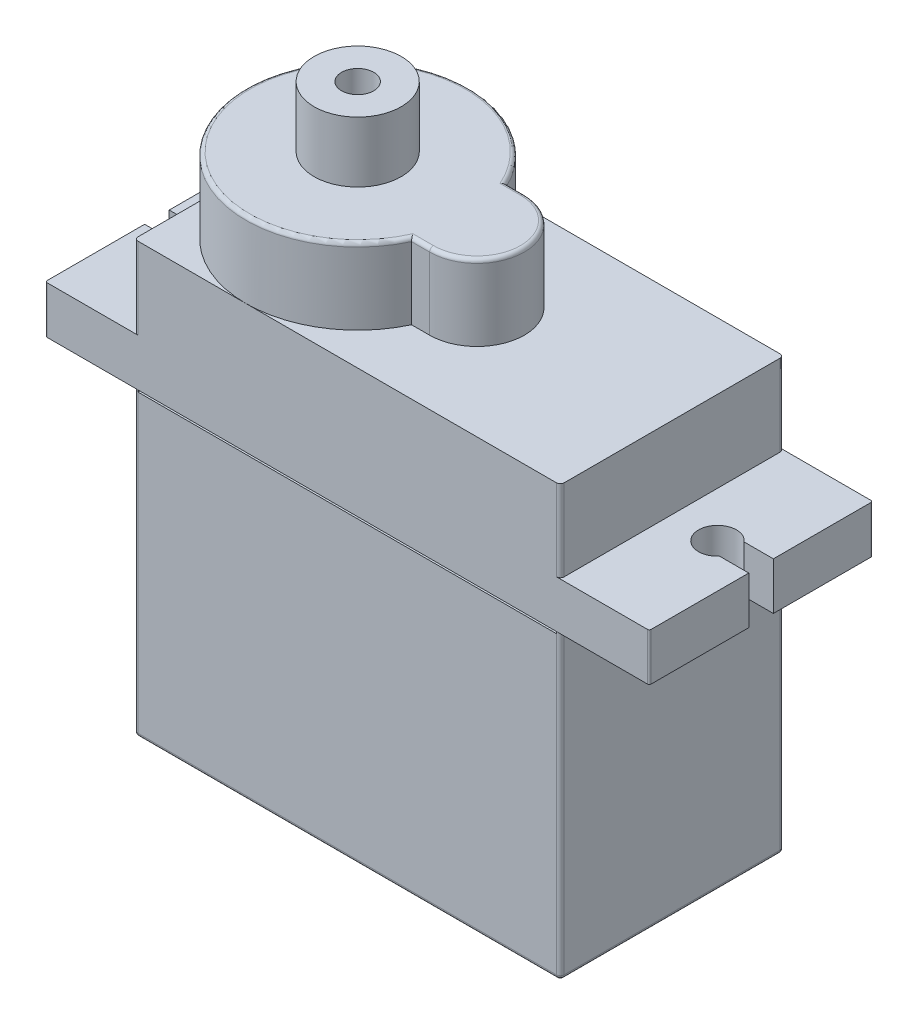
from build123d import *

# Parameters (mm, degrees)
SKETCH1_W                     = 22.5
SKETCH1_H                     = 22.7
BOSS_EXTRUDE1_DEPTH           = 11.8
SKETCH2_W                     = 11.8
SKETCH2_H                     = 2.5
BOSS_EXTRUDE2_DEPTH           = 4.7
SKETCH3_W                     = 11.8
SKETCH3_H                     = 2.5
BOSS_EXTRUDE3_DEPTH           = 4.7
CUT_EXTRUDE1_DEPTH            = 4.7
BOSS_EXTRUDE4_DEPTH           = 4
SKETCH6_R                     = 2.3
SKETCH6_R_2                   = 0.85
BOSS_EXTRUDE5_DEPTH           = 3.2
CUT_EXTRUDE2_DEPTH            = 0.1
FILLET1_R                     = 0.2
SKETCH8_W                     = 22.1
SKETCH8_H                     = 0.1
CUT_EXTRUDE3_DEPTH            = 0.1
SKETCH9_W                     = 22.1
SKETCH9_H                     = 0.1
CUT_EXTRUDE4_DEPTH            = 0.1
FILLET2_R                     = 0.1
SALIENTE_EXTRUIR1_START       = -1
SALIENTE_EXTRUIR1_OUTLINE_R   = 0.495696025
SALIENTE_EXTRUIR1_OUTLINE_R_2 = 0.5
SALIENTE_EXTRUIR1_DEPTH       = 4


with BuildPart() as part:
    # Sketch1 → Boss-Extrude1 (new body)
    with BuildSketch(Plane.XY):
        with Locations((11.25, 11.35)):
            Rectangle(SKETCH1_W, SKETCH1_H)
    extrude(amount=BOSS_EXTRUDE1_DEPTH)

    # Sketch2 → Boss-Extrude2 (add)
    with BuildSketch(Plane(origin=(22.5, 0, 0), x_dir=(0, 0, -1), z_dir=(1, 0, 0))):
        with Locations((-5.9, 17.15)):
            Rectangle(SKETCH2_W, SKETCH2_H)
    extrude(amount=BOSS_EXTRUDE2_DEPTH)

    # Sketch3 → Boss-Extrude3 (add)
    with BuildSketch(Plane.ZY):
        with Locations((5.9, 17.15)):
            Rectangle(SKETCH3_W, SKETCH3_H)
    extrude(amount=BOSS_EXTRUDE3_DEPTH)

    # Sketch4 → Cut-Extrude1 (cut)
    with BuildSketch(Plane(origin=(0, 18.4, 0), x_dir=(1, 0, 0), z_dir=(0, 1, 0))):
        with BuildLine():
            Line((27.2, -5.25), (25.659934208, -5.25))
            ThreePointArc((25.659934208, -5.25), (23.9, -5.9), (25.659934208, -6.55))
            Line((25.659934208, -6.55), (27.2, -6.55))
            Line((27.2, -6.55), (27.2, -5.25))
        make_face()
        with BuildLine():
            Line((-4.7, -5.25), (-3.159934208, -5.25))
            ThreePointArc((-3.159934208, -5.25), (-1.4, -5.9), (-3.159934208, -6.55))
            Line((-3.159934208, -6.55), (-4.7, -6.55))
            Line((-4.7, -6.55), (-4.7, -5.25))
        make_face()
    extrude(amount=-CUT_EXTRUDE1_DEPTH, mode=Mode.SUBTRACT)

    # Sketch5 → Boss-Extrude4 (add)
    with BuildSketch(Plane(origin=(0, 22.7, 0), x_dir=(1, 0, 0), z_dir=(0, 1, 0))):
        with BuildLine():
            Line((12.2, -3.4), (11.244155686, -3.4))
            ThreePointArc((11.244155686, -3.4), (0, -5.9), (11.244155686, -8.4))
            Line((11.244155686, -8.4), (12.2, -8.4))
            ThreePointArc((12.2, -8.4), (14.7, -5.9), (12.2, -3.4))
        make_face()
    extrude(amount=BOSS_EXTRUDE4_DEPTH)

    # Sketch6 → Boss-Extrude5 (add)
    with BuildSketch(Plane(origin=(0, 26.7, 0), x_dir=(1, 0, 0), z_dir=(0, 1, 0))):
        with Locations(Location((5.9, -5.9, 0), (0, 0, 270))):
            Circle(SKETCH6_R)
        with Locations(Location((5.9, -5.9, 0), (0, 0, 270))):
            Circle(SKETCH6_R_2, mode=Mode.SUBTRACT)
    extrude(amount=BOSS_EXTRUDE5_DEPTH)

    # Sketch7 → Cut-Extrude2 (cut)
    # profile 1 of 4: a face of its own
    with BuildSketch(Plane(origin=(0, 0, 0), x_dir=(-1, 0, 0), z_dir=(0, 0, -1))):
        with BuildLine():
            Line((-17.532795325, 8.733140918), (-17.236921928, 8.910524733))
            add(Edge.make_bspline(
                [(-17.236921928, 8.910524733), (-17.209403691, 8.864460348), (-17.15667981, 8.776202764), (-17.068728451, 8.656944723), (-16.97759554, 8.555582566), (-16.882606206, 8.472705959), (-16.784340258, 8.407457072), (-16.682156204, 8.36125484), (-16.576398394, 8.332438865), (-16.504424572, 8.328938779), (-16.468492441, 8.327191399)],
                knots=[0, 0, 0, 0, 1.272034388, 2.437168799, 3.508375237, 4.49857839, 5.41946034, 6.295179144, 7.148887113, 8, 8, 8, 8], degree=3))
            add(Edge.make_bspline(
                [(-16.468492441, 8.327191399), (-16.43780558, 8.328046072), (-16.376968807, 8.329740462), (-16.287406564, 8.346021264), (-16.200424762, 8.371033393), (-16.117816124, 8.406854324), (-16.04072051, 8.45019281), (-15.973113814, 8.502538988), (-15.914667701, 8.561145193), (-15.866858587, 8.626527848), (-15.830178551, 8.696844997), (-15.801986483, 8.769020948), (-15.786341409, 8.844189516), (-15.783984656, 8.894799979), (-15.782795325, 8.920340438)],
                knots=[0, 0, 0, 0, 1.095163259, 2.171163733, 3.241058638, 4.321873601, 5.38011039, 6.391990106, 7.366004449, 8.327778327, 9.272591725, 10.192022065, 11.087607919, 12, 12, 12, 12], degree=3))
            add(Edge.make_bspline(
                [(-15.782795325, 8.920340438), (-15.784269636, 8.949481287), (-15.787266694, 9.008720376), (-15.812598174, 9.096120029), (-15.852447421, 9.182612599), (-15.889210065, 9.236113865), (-15.908296127, 9.263890117)],
                knots=[0, 0, 0, 0, 0.938893495, 1.908633276, 2.914225137, 4, 4, 4, 4], degree=3))
            add(Edge.make_bspline(
                [(-15.908296127, 9.263890117), (-15.923966741, 9.283936941), (-15.956865235, 9.326022739), (-16.013422748, 9.388667975), (-16.079788862, 9.453286394), (-16.153692417, 9.522345451), (-16.237825506, 9.592633247), (-16.32955302, 9.667501525), (-16.431216879, 9.744103102), (-16.502516376, 9.795475668), (-16.539305742, 9.821983066)],
                knots=[0, 0, 0, 0, 0.722233717, 1.516239348, 2.393582979, 3.351407094, 4.387010283, 5.505090956, 6.712668013, 8, 8, 8, 8], degree=3))
            add(Edge.make_bspline(
                [(-16.539305742, 9.821983066), (-16.576129738, 9.848211653), (-16.646534415, 9.898358716), (-16.744992997, 9.972783), (-16.83303746, 10.040826869), (-16.910276477, 10.103130881), (-16.976676073, 10.159703486), (-17.032759484, 10.210001425), (-17.077098042, 10.255384986), (-17.101753622, 10.284826328), (-17.11282337, 10.298044765)],
                knots=[0, 0, 0, 0, 1.452282411, 2.77665338, 3.964542531, 5.026858415, 5.96415736, 6.766646006, 7.446254459, 8, 8, 8, 8], degree=3))
            add(Edge.make_bspline(
                [(-17.11282337, 10.298044765), (-17.128295915, 10.318645801), (-17.158724752, 10.359160505), (-17.198890758, 10.422485363), (-17.23302992, 10.487308628), (-17.259792252, 10.553804493), (-17.282328471, 10.621039422), (-17.297486402, 10.689890668), (-17.306977799, 10.760049286), (-17.307949786, 10.807262787), (-17.308436351, 10.830897329)],
                knots=[0, 0, 0, 0, 1.068054152, 2.10047183, 3.106115577, 4.101338837, 5.06977816, 6.043150881, 7.020423561, 8, 8, 8, 8], degree=3))
            add(Edge.make_bspline(
                [(-17.308436351, 10.830897329), (-17.307131142, 10.867927103), (-17.304548622, 10.941195167), (-17.282708105, 11.048225997), (-17.248235211, 11.150412415), (-17.199940323, 11.246742748), (-17.13768297, 11.334708729), (-17.065636996, 11.415322216), (-16.97982551, 11.483090798), (-16.885672886, 11.542302857), (-16.782616514, 11.588648782), (-16.674625611, 11.623609762), (-16.561528539, 11.64341902), (-16.484925404, 11.646261785), (-16.446056543, 11.64770422)],
                knots=[0, 0, 0, 0, 1.005424448, 1.989358655, 2.955360095, 3.929531133, 4.905563448, 5.876582895, 6.856512386, 7.866279853, 8.892233794, 9.918561126, 10.94386622, 12, 12, 12, 12], degree=3))
            add(Edge.make_bspline(
                [(-16.446056543, 11.64770422), (-16.404812443, 11.646281668), (-16.322791091, 11.643452667), (-16.202141876, 11.618855136), (-16.085981159, 11.578154464), (-15.992537894, 11.531965806), (-15.919405133, 11.48583439), (-15.8636324, 11.443814566), (-15.807114949, 11.395439457), (-15.749396895, 11.340580211), (-15.691456235, 11.27873346), (-15.632432783, 11.210322771), (-15.572188514, 11.135766215), (-15.533432654, 11.082541715), (-15.513564556, 11.055256303)],
                knots=[0, 0, 0, 0, 1.286793592, 2.559021753, 3.825965368, 5.121522368, 5.803751409, 6.523245864, 7.299691795, 8.125521123, 9.008227632, 9.944561021, 10.946284179, 12, 12, 12, 12], degree=3))
            Line((-15.513564556, 11.055256303), (-15.797518883, 10.840011912))
            add(Edge.make_bspline(
                [(-15.797518883, 10.840011912), (-15.814664815, 10.862100602), (-15.847683873, 10.904638256), (-15.897813359, 10.964209571), (-15.945062007, 11.018626051), (-15.991612407, 11.065891179), (-16.035006039, 11.108593312), (-16.077123081, 11.145153069), (-16.117357432, 11.175928664), (-16.168074343, 11.208772224), (-16.231792061, 11.241328728), (-16.311776597, 11.268877806), (-16.395362872, 11.285432868), (-16.452292504, 11.287621755), (-16.481112633, 11.288729861)],
                knots=[0, 0, 0, 0, 1.181633172, 2.275549214, 3.290209073, 4.226197932, 5.078386478, 5.862611352, 6.581680152, 7.217281963, 8.414376989, 9.595101626, 10.782541182, 12, 12, 12, 12], degree=3))
            add(Edge.make_bspline(
                [(-16.481112633, 11.288729861), (-16.517269155, 11.287518161), (-16.586993603, 11.285181512), (-16.685983839, 11.259661526), (-16.775077764, 11.219479666), (-16.851630329, 11.163164688), (-16.915367306, 11.096443695), (-16.961472765, 11.01966484), (-16.989222929, 10.934882437), (-16.992609209, 10.875740781), (-16.994333787, 10.845620886)],
                knots=[0, 0, 0, 0, 1.14458467, 2.207223713, 3.21896685, 4.227309161, 5.202851033, 6.127160689, 7.046193047, 8, 8, 8, 8], degree=3))
            add(Edge.make_bspline(
                [(-16.994333787, 10.845620886), (-16.99394066, 10.826869408), (-16.993153764, 10.789335788), (-16.982178966, 10.733884366), (-16.968079637, 10.678573027), (-16.945737006, 10.623650444), (-16.914891702, 10.568156085), (-16.874386526, 10.511134348), (-16.823373214, 10.452082639), (-16.784296202, 10.413675265), (-16.763664716, 10.393397329)],
                knots=[0, 0, 0, 0, 0.858281714, 1.717966888, 2.583508476, 3.4729293, 4.427298488, 5.488583878, 6.674047936, 8, 8, 8, 8], degree=3))
            add(Edge.make_bspline(
                [(-16.763664716, 10.393397329), (-16.756003344, 10.386560303), (-16.737801677, 10.370317095), (-16.704525751, 10.343724814), (-16.660582953, 10.310922042), (-16.607120752, 10.270334725), (-16.54315339, 10.223253263), (-16.468673834, 10.170279651), (-16.384512301, 10.109694192), (-16.324790385, 10.067336651), (-16.293211992, 10.044939797)],
                knots=[0, 0, 0, 0, 0.420754252, 0.999615792, 1.744751191, 2.668019286, 3.750313428, 4.999500688, 6.413464383, 8, 8, 8, 8], degree=3))
            add(Edge.make_bspline(
                [(-16.293211992, 10.044939797), (-16.255226079, 10.017298437), (-16.181671622, 9.963774775), (-16.077014042, 9.883359095), (-15.982120234, 9.804711327), (-15.896657031, 9.72833372), (-15.819780122, 9.654805627), (-15.752342402, 9.583242446), (-15.693656721, 9.514156874), (-15.630477503, 9.425584298), (-15.565919683, 9.316803214), (-15.510478176, 9.183524975), (-15.475519828, 9.049728655), (-15.470948313, 8.959801818), (-15.468692761, 8.915432585)],
                knots=[0, 0, 0, 0, 1.163667725, 2.253281268, 3.268753668, 4.215851969, 5.092017293, 5.902905408, 6.650798638, 7.335211899, 8.59617414, 9.77448103, 10.901945474, 12, 12, 12, 12], degree=3))
            add(Edge.make_bspline(
                [(-15.468692761, 8.915432585), (-15.469349899, 8.88405422), (-15.470651414, 8.821906836), (-15.485612328, 8.73065176), (-15.507531993, 8.64202089), (-15.540569227, 8.557109777), (-15.580892386, 8.474365015), (-15.632058633, 8.395957114), (-15.691366318, 8.320150716), (-15.759400083, 8.248967224), (-15.833845985, 8.183621028), (-15.91252968, 8.125491967), (-15.995579953, 8.077023644), (-16.08254627, 8.037472801), (-16.173448606, 8.006539284), (-16.26825639, 7.984126415), (-16.367125901, 7.970370704), (-16.434326383, 7.968942942), (-16.468492441, 7.96821704)],
                knots=[0, 0, 0, 0, 0.983748083, 1.948392443, 2.894712957, 3.844097841, 4.80183111, 5.778335162, 6.776009319, 7.81870978, 8.863265674, 9.881300176, 10.883814829, 11.87499822, 12.874611388, 13.892143829, 14.928324115, 16, 16, 16, 16], degree=3))
            add(Edge.make_bspline(
                [(-16.468492441, 7.96821704), (-16.494927784, 7.968728222), (-16.547465544, 7.969744147), (-16.625175026, 7.978725428), (-16.701314615, 7.991432531), (-16.774928897, 8.011606601), (-16.846966308, 8.036083578), (-16.917113543, 8.066221911), (-16.985404597, 8.102339112), (-17.05222218, 8.143634137), (-17.117396354, 8.191691881), (-17.180315822, 8.247665378), (-17.243045008, 8.310010883), (-17.303732404, 8.380421446), (-17.363605548, 8.457759529), (-17.421483958, 8.542748713), (-17.478565676, 8.634926066), (-17.514381143, 8.699791152), (-17.532795325, 8.733140918)],
                knots=[0, 0, 0, 0, 0.915332311, 1.819136955, 2.706846663, 3.586547465, 4.459518054, 5.340707479, 6.227863349, 7.133153174, 8.059268498, 9.028702269, 10.047606654, 11.120612155, 12.245963614, 13.433783089, 14.680604001, 16, 16, 16, 16], degree=3))
        make_face()
    # profile 2 of 4: a face of its own
    with BuildSketch(Plane(origin=(0, 0, 0), x_dir=(-1, 0, 0), z_dir=(0, 0, -1))):
        with BuildLine():
            Line((-11.475103018, 10.960604861), (-11.744333787, 10.705396527))
            add(Edge.make_bspline(
                [(-11.744333787, 10.705396527), (-11.793052675, 10.75122739), (-11.889328721, 10.841796253), (-12.046288964, 10.959307248), (-12.210052598, 11.059973349), (-12.379765095, 11.141879585), (-12.551223649, 11.207232346), (-12.722152425, 11.253760486), (-12.890798127, 11.283433023), (-13.002965345, 11.286981393), (-13.05823603, 11.288729861)],
                knots=[0, 0, 0, 0, 1.08915593, 2.152340314, 3.188132944, 4.216796309, 5.218260357, 6.173443236, 7.099959455, 8, 8, 8, 8], degree=3))
            add(Edge.make_bspline(
                [(-13.05823603, 11.288729861), (-13.09215073, 11.288316255), (-13.159892171, 11.287490116), (-13.260514115, 11.2769459), (-13.360080752, 11.261781036), (-13.458404127, 11.239839159), (-13.555675413, 11.212030099), (-13.651556305, 11.177244636), (-13.74622566, 11.136689392), (-13.838791741, 11.089826918), (-13.928532245, 11.038347072), (-14.01328908, 10.981298531), (-14.093602479, 10.920509741), (-14.167962905, 10.854458762), (-14.236798091, 10.783743896), (-14.301746463, 10.70968059), (-14.360523759, 10.630245372), (-14.413614924, 10.546899746), (-14.460976542, 10.461107556), (-14.502785196, 10.373694567), (-14.537882284, 10.284950712), (-14.565651739, 10.194764635), (-14.588562393, 10.103834045), (-14.60468, 10.011529324), (-14.613766723, 9.917751639), (-14.615338503, 9.85495438), (-14.616128659, 9.823385309)],
                knots=[0, 0, 0, 0, 1.02818874, 2.053710826, 3.065248034, 4.081641283, 5.106893873, 6.131558223, 7.173050175, 8.228653731, 9.27666206, 10.308777013, 11.325269123, 12.329503258, 13.32196095, 14.316845687, 15.314881793, 16.315733098, 17.311955233, 18.285320748, 19.252783886, 20.203351036, 21.145449891, 22.095197417, 23.042428769, 24, 24, 24, 24], degree=3))
            add(Edge.make_bspline(
                [(-14.616128659, 9.823385309), (-14.61537294, 9.791114492), (-14.613863567, 9.726660979), (-14.604203248, 9.630466906), (-14.586275007, 9.535701504), (-14.562307299, 9.442053371), (-14.532326483, 9.349362123), (-14.494953817, 9.258029613), (-14.450688216, 9.168059222), (-14.399451664, 9.080261605), (-14.343265461, 8.994738581), (-14.28032238, 8.91417906), (-14.213461796, 8.837510282), (-14.140247897, 8.766434519), (-14.063028354, 8.699050622), (-13.979496078, 8.6372151), (-13.891293618, 8.579736877), (-13.798286406, 8.527340358), (-13.701483623, 8.480531822), (-13.60222687, 8.438907926), (-13.500199055, 8.404628589), (-13.395936365, 8.376690485), (-13.289563093, 8.353790187), (-13.180539291, 8.339057707), (-13.069666582, 8.328366876), (-12.99492795, 8.327585206), (-12.957274492, 8.327191399)],
                knots=[0, 0, 0, 0, 0.93586088, 1.869166235, 2.799637598, 3.729985548, 4.670839027, 5.622275134, 6.589130586, 7.576015415, 8.568469353, 9.55398029, 10.53834874, 11.515998671, 12.510579167, 13.508179873, 14.527009472, 15.561807829, 16.601455013, 17.643573243, 18.680854198, 19.719860599, 20.772568776, 21.833555941, 22.908541556, 24, 24, 24, 24], degree=3))
            add(Edge.make_bspline(
                [(-12.957274492, 8.327191399), (-12.911896145, 8.328139975), (-12.822788387, 8.330002659), (-12.691801945, 8.344502949), (-12.565998874, 8.367149742), (-12.445732671, 8.400315639), (-12.33086365, 8.442619314), (-12.220970709, 8.4936147), (-12.11691905, 8.555257759), (-12.018395877, 8.624831627), (-11.927638691, 8.702346459), (-11.845784567, 8.785990914), (-11.774139078, 8.875358981), (-11.711634378, 8.969924296), (-11.659925724, 9.070469601), (-11.617482929, 9.176502164), (-11.584949637, 9.288069676), (-11.571594663, 9.365161307), (-11.564846607, 9.404114476)],
                knots=[0, 0, 0, 0, 1.13008108, 2.219097802, 3.278683437, 4.311054135, 5.322181354, 6.324827112, 7.324222904, 8.330512327, 9.32562643, 10.293043162, 11.24128371, 12.174520618, 13.111833804, 14.052305215, 15.015860969, 16, 16, 16, 16], degree=3))
            Line((-11.564846607, 9.404114476), (-12.731513274, 9.404114476))
            Line((-12.731513274, 9.404114476), (-12.731513274, 9.763088835))
            Line((-12.731513274, 9.763088835), (-11.250744043, 9.763088835))
            add(Edge.make_bspline(
                [(-11.250744043, 9.763088835), (-11.252449892, 9.696181346), (-11.255788545, 9.565231304), (-11.279207461, 9.374261034), (-11.317023973, 9.19388934), (-11.368684285, 9.023926269), (-11.435559565, 8.864612676), (-11.516932094, 8.71578681), (-11.614104215, 8.578410129), (-11.723614656, 8.451361125), (-11.846514614, 8.338031913), (-11.979483234, 8.238425975), (-12.122740202, 8.15452336), (-12.27615001, 8.086262697), (-12.439210443, 8.032988703), (-12.612298823, 7.995217126), (-12.795180424, 7.972587162), (-12.920517101, 7.969695783), (-12.984618242, 7.96821704)],
                knots=[0, 0, 0, 0, 1.140356446, 2.231883559, 3.274166699, 4.278491846, 5.25512956, 6.21435461, 7.1637429, 8.11826594, 9.068280886, 10.0076534, 10.945064095, 11.891975133, 12.864533718, 13.863980011, 14.907571808, 16, 16, 16, 16], degree=3))
            add(Edge.make_bspline(
                [(-12.984618242, 7.96821704), (-13.024128377, 7.968786161), (-13.102055098, 7.969908652), (-13.217146026, 7.977885999), (-13.329063647, 7.990166576), (-13.437791656, 8.008711699), (-13.543729998, 8.031426353), (-13.646349583, 8.060513072), (-13.746041325, 8.094181771), (-13.84295931, 8.132477445), (-13.936223857, 8.176849102), (-14.026250374, 8.226158741), (-14.1135365, 8.280152102), (-14.197487665, 8.339762948), (-14.278541286, 8.404545408), (-14.35617473, 8.474629327), (-14.430822608, 8.549800446), (-14.477583072, 8.603179456), (-14.501144684, 8.630076015)],
                knots=[0, 0, 0, 0, 1.107784379, 2.184907829, 3.233506516, 4.263428166, 5.276301166, 6.270063455, 7.25232949, 8.225834625, 9.190232166, 10.146266622, 11.1027726, 12.066435141, 13.031522626, 14.010570082, 14.99756817, 16, 16, 16, 16], degree=3))
            add(Edge.make_bspline(
                [(-14.501144684, 8.630076015), (-14.535330616, 8.672746668), (-14.603135029, 8.757379685), (-14.690413185, 8.892979629), (-14.764814588, 9.033381489), (-14.82518241, 9.178976118), (-14.872320497, 9.329627331), (-14.906126749, 9.485142622), (-14.925934039, 9.645722252), (-14.928787576, 9.754387517), (-14.930231223, 9.809362874)],
                knots=[0, 0, 0, 0, 1.023165419, 2.029347347, 3.013907458, 3.994755782, 4.975994455, 5.96558838, 6.970761222, 8, 8, 8, 8], degree=3))
            add(Edge.make_bspline(
                [(-14.930231223, 9.809362874), (-14.929698985, 9.850529126), (-14.928641273, 9.932338434), (-14.915815757, 10.053795741), (-14.897414339, 10.173096433), (-14.870367284, 10.29014299), (-14.836271019, 10.405013581), (-14.793717533, 10.517761545), (-14.744172637, 10.628453417), (-14.686587141, 10.736327285), (-14.622502682, 10.839951698), (-14.552952461, 10.938909501), (-14.476948861, 11.031398566), (-14.395733062, 11.118590214), (-14.308336071, 11.199389061), (-14.215576648, 11.274543172), (-14.117383305, 11.344153358), (-14.013447125, 11.407123192), (-13.90531944, 11.463686813), (-13.793259439, 11.513276025), (-13.677301328, 11.55425934), (-13.55831385, 11.58903312), (-13.43539635, 11.61474826), (-13.309440813, 11.633397006), (-13.179790701, 11.646157605), (-13.092154672, 11.647183861), (-13.047719203, 11.64770422)],
                knots=[0, 0, 0, 0, 1.008945113, 2.00506715, 2.99143336, 3.967273523, 4.948097931, 5.927297278, 6.919902385, 7.919676788, 8.923139349, 9.905703106, 10.883022732, 11.856032218, 12.825136022, 13.798837087, 14.781400844, 15.773989409, 16.776158564, 17.77167057, 18.775803737, 19.789618931, 20.80898985, 21.851988756, 22.910860228, 24, 24, 24, 24], degree=3))
            add(Edge.make_bspline(
                [(-13.047719203, 11.64770422), (-13.01148096, 11.647124728), (-12.939624781, 11.645975664), (-12.832699049, 11.638011016), (-12.727426034, 11.625387135), (-12.623649644, 11.608160348), (-12.521723278, 11.584696658), (-12.421356573, 11.556618373), (-12.322404036, 11.52392655), (-12.225175787, 11.484937704), (-12.129018071, 11.440684079), (-12.033396231, 11.390870657), (-11.938636985, 11.334645652), (-11.844576003, 11.271842117), (-11.750620145, 11.203538699), (-11.658255503, 11.127781875), (-11.565252559, 11.047559119), (-11.505450745, 10.989876935), (-11.475103018, 10.960604861)],
                knots=[0, 0, 0, 0, 0.985871117, 1.954866573, 2.915460327, 3.869826059, 4.81536089, 5.759505086, 6.70452669, 7.649098992, 8.607881297, 9.583363685, 10.581137262, 11.603961102, 12.659522466, 13.73993555, 14.853081303, 16, 16, 16, 16], degree=3))
        make_face()
    # profile 3 of 4: a face of its own
    with BuildSketch(Plane(origin=(0, 0, 0), x_dir=(-1, 0, 0), z_dir=(0, 0, -1))):
        with BuildLine():
            Line((-8.73792353, 7.96821704), (-8.988925133, 8.142796367))
            Line((-8.988925133, 8.142796367), (-8.015768082, 9.565372489))
            add(Edge.make_bspline(
                [(-8.015768082, 9.565372489), (-8.077858817, 9.557779426), (-8.200118937, 9.542828261), (-8.323256039, 9.540081606), (-8.383857024, 9.538729861)],
                knots=[0, 0, 0, 0, 1.015715272, 2, 2, 2, 2], degree=3))
            add(Edge.make_bspline(
                [(-8.383857024, 9.538729861), (-8.420599072, 9.539670937), (-8.492720499, 9.541518188), (-8.598752151, 9.556159996), (-8.700637712, 9.578710124), (-8.798107068, 9.612358879), (-8.891526573, 9.654177088), (-8.980692286, 9.706034102), (-9.065484176, 9.767040393), (-9.144991586, 9.836873385), (-9.217303325, 9.913551437), (-9.281726623, 9.99470708), (-9.335267755, 10.081283051), (-9.37974434, 10.17151327), (-9.413474794, 10.266694621), (-9.438037332, 10.365744021), (-9.453159686, 10.469355663), (-9.454958781, 10.539880794), (-9.455872248, 10.575688995)],
                knots=[0, 0, 0, 0, 1.060718605, 2.082097864, 3.085795603, 4.069760067, 5.054557537, 6.03741023, 7.043284206, 8.066802108, 9.088538119, 10.083643548, 11.053783639, 12.022749082, 12.983451788, 13.964007469, 14.966251758, 16, 16, 16, 16], degree=3))
            add(Edge.make_bspline(
                [(-9.455872248, 10.575688995), (-9.454137814, 10.624657648), (-9.45073347, 10.72077318), (-9.423334953, 10.861206949), (-9.378274613, 10.993993492), (-9.315446237, 11.118783686), (-9.236311515, 11.233782425), (-9.141202925, 11.337391035), (-9.030698961, 11.428135888), (-8.907316942, 11.506139966), (-8.773963921, 11.568874963), (-8.634295263, 11.615114264), (-8.489381143, 11.642313011), (-8.391213473, 11.645898873), (-8.341789716, 11.64770422)],
                knots=[0, 0, 0, 0, 1.022988612, 2.007919123, 2.978103895, 3.94594894, 4.918897164, 5.887013414, 6.875921846, 7.89917871, 8.930658928, 9.948724884, 10.967259574, 12, 12, 12, 12], degree=3))
            add(Edge.make_bspline(
                [(-8.341789716, 11.64770422), (-8.293301297, 11.645874057), (-8.19749275, 11.642257827), (-8.056603743, 11.615773858), (-7.921662726, 11.571137185), (-7.79341774, 11.509452621), (-7.674678327, 11.432131714), (-7.567902516, 11.33999719), (-7.475526977, 11.232991663), (-7.397703096, 11.113703173), (-7.335233056, 10.985536191), (-7.290160773, 10.851752269), (-7.262415134, 10.713313548), (-7.258918807, 10.619519074), (-7.2571543, 10.572183386)],
                knots=[0, 0, 0, 0, 1.026385292, 2.028040595, 3.023318987, 4.028184125, 5.03290303, 6.015178782, 7.004435299, 8.016004309, 9.023023918, 10.015172535, 10.998308025, 12, 12, 12, 12], degree=3))
            add(Edge.make_bspline(
                [(-7.2571543, 10.572183386), (-7.258332709, 10.535439619), (-7.260722816, 10.460914079), (-7.277459123, 10.347683736), (-7.305879309, 10.232232506), (-7.338131007, 10.13451091), (-7.369263175, 10.053802461), (-7.398564307, 9.990050881), (-7.43107646, 9.922949617), (-7.468995226, 9.853202279), (-7.509757522, 9.779919745), (-7.555816799, 9.703837029), (-7.606122371, 9.624852036), (-7.64195209, 9.571604948), (-7.660299332, 9.544338835)],
                knots=[0, 0, 0, 0, 1.179839688, 2.393009684, 3.667231171, 4.993948276, 5.694988576, 6.444077775, 7.246288328, 8.089075292, 8.993003841, 9.939041771, 10.944649915, 12, 12, 12, 12], degree=3))
            Line((-7.660299332, 9.544338835), (-8.73792353, 7.96821704))
        make_face()
        with BuildLine():
            add(Edge.make_bspline(
                [(-8.325663915, 9.89770422), (-8.297829901, 9.898464603), (-8.243646538, 9.899944812), (-8.164269239, 9.908954054), (-8.089345035, 9.92492804), (-8.018673786, 9.947847752), (-7.951546884, 9.975504421), (-7.889030556, 10.010716407), (-7.831072481, 10.052733042), (-7.777284554, 10.099943058), (-7.729520554, 10.152393641), (-7.686977523, 10.207290748), (-7.650816956, 10.264875358), (-7.622253679, 10.32586862), (-7.598769103, 10.388785829), (-7.582551091, 10.454640184), (-7.573566758, 10.523088585), (-7.572035183, 10.569587243), (-7.571256864, 10.59321704)],
                knots=[0, 0, 0, 0, 1.163407946, 2.26475976, 3.333800367, 4.359385343, 5.366239384, 6.363380779, 7.350133999, 8.353570782, 9.349036268, 10.310270964, 11.253520213, 12.184142, 13.120487599, 14.056272588, 15.012232024, 16, 16, 16, 16], degree=3))
            add(Edge.make_bspline(
                [(-7.571256864, 10.59321704), (-7.571926533, 10.616856705), (-7.573246198, 10.663441565), (-7.583833498, 10.731991305), (-7.602458721, 10.797684566), (-7.627449206, 10.860880996), (-7.660369444, 10.921061368), (-7.699872929, 10.97898124), (-7.746805379, 11.034273367), (-7.800807945, 11.085637351), (-7.859042498, 11.13298525), (-7.921102998, 11.174771326), (-7.986477914, 11.209792523), (-8.054768404, 11.238691493), (-8.126116753, 11.261243268), (-8.200480741, 11.277460633), (-8.278236147, 11.286432387), (-8.331017433, 11.287954282), (-8.357915518, 11.288729861)],
                knots=[0, 0, 0, 0, 0.972161553, 1.915763587, 2.844109794, 3.775983486, 4.705125789, 5.659731448, 6.655561913, 7.682237399, 8.721216875, 9.739758359, 10.754845918, 11.767244016, 12.7857855, 13.828538656, 14.893392813, 16, 16, 16, 16], degree=3))
            add(Edge.make_bspline(
                [(-8.357915518, 11.288729861), (-8.384579671, 11.287953029), (-8.43689452, 11.286428892), (-8.51395868, 11.277477687), (-8.587819848, 11.261134202), (-8.658961468, 11.238701938), (-8.727249928, 11.209790367), (-8.792621761, 11.174769491), (-8.854696778, 11.132994869), (-8.912875499, 11.085600097), (-8.966973421, 11.03451245), (-9.01309895, 10.978739021), (-9.052692842, 10.921091497), (-9.085567845, 10.860872989), (-9.110570362, 10.797686703), (-9.129192364, 10.731990726), (-9.139780529, 10.663441716), (-9.141100075, 10.616856756), (-9.141769684, 10.59321704)],
                knots=[0, 0, 0, 0, 1.099389452, 2.15699305, 3.192601482, 4.213358962, 5.227959689, 6.245255729, 7.266013209, 8.307253147, 9.336162325, 10.327954924, 11.284637477, 12.215801273, 13.149702402, 14.080068371, 15.025723358, 16, 16, 16, 16], degree=3))
            add(Edge.make_bspline(
                [(-9.141769684, 10.59321704), (-9.141163758, 10.569568841), (-9.139968761, 10.522930265), (-9.128440971, 10.454403872), (-9.109162691, 10.388715678), (-9.083343301, 10.325226971), (-9.049341711, 10.264555113), (-9.007617863, 10.206987751), (-8.958712317, 10.151872301), (-8.903278829, 10.100065089), (-8.842610668, 10.052512914), (-8.777813922, 10.010982532), (-8.710004085, 9.975910087), (-8.638942454, 9.947768703), (-8.565155654, 9.92515704), (-8.487980523, 9.908983495), (-8.407672286, 9.900031228), (-8.353262304, 9.898487331), (-8.325663915, 9.89770422)],
                knots=[0, 0, 0, 0, 0.952633368, 1.87876736, 2.791047057, 3.707742249, 4.635551637, 5.587206343, 6.568248508, 7.601284464, 8.641511608, 9.671105535, 10.699146789, 11.713763218, 12.747829548, 13.806491675, 14.887386225, 16, 16, 16, 16], degree=3))
        make_face(mode=Mode.SUBTRACT)
    # profile 4 of 4: a face of its own
    with BuildSketch(Plane(origin=(0, 0, 0), x_dir=(-1, 0, 0), z_dir=(0, 0, -1))):
        with BuildLine():
            add(Edge.make_bspline(
                [(-6.808436351, 9.806558386), (-6.808108333, 9.862655774), (-6.807471153, 9.971625758), (-6.800382732, 10.1304104), (-6.78860739, 10.279370689), (-6.772470017, 10.418513755), (-6.752832036, 10.54787552), (-6.72661655, 10.667110277), (-6.696803747, 10.776769884), (-6.662251301, 10.877211932), (-6.623263512, 10.969789635), (-6.580829252, 11.056214837), (-6.533264457, 11.136356769), (-6.483287544, 11.211494559), (-6.428875473, 11.280398254), (-6.371576682, 11.344040917), (-6.309154806, 11.400951667), (-6.243731798, 11.452797969), (-6.174715333, 11.498247441), (-6.104072667, 11.53828018), (-6.031317561, 11.572480047), (-5.956251378, 11.599370483), (-5.879548821, 11.62158133), (-5.800941754, 11.636770277), (-5.72030039, 11.646327186), (-5.665868955, 11.647240853), (-5.638264075, 11.64770422)],
                knots=[0, 0, 0, 0, 1.646270934, 3.197905019, 4.663502075, 6.030701355, 7.308322542, 8.50163776, 9.611534131, 10.641858119, 11.616356847, 12.558055219, 13.465016945, 14.349605745, 15.204443733, 16.039544428, 16.859896111, 17.680448484, 18.487036065, 19.28249412, 20.06191084, 20.843045899, 21.620316918, 22.403196591, 23.190181807, 24, 24, 24, 24], degree=3))
            add(Edge.make_bspline(
                [(-5.638264075, 11.64770422), (-5.610428597, 11.647216405), (-5.555072588, 11.646246294), (-5.473232213, 11.636922351), (-5.393282531, 11.621451228), (-5.315564392, 11.599530253), (-5.239439406, 11.572334577), (-5.165502998, 11.53824746), (-5.093295916, 11.498568592), (-5.023965629, 11.451944715), (-4.956751014, 11.399962439), (-4.893303051, 11.34119977), (-4.833615965, 11.276250051), (-4.776940659, 11.205808187), (-4.724885062, 11.128523102), (-4.67531163, 11.045738992), (-4.630939594, 10.956008127), (-4.588204919, 10.86082766), (-4.551317932, 10.757564001), (-4.518051687, 10.64679924), (-4.491172718, 10.527225053), (-4.468783446, 10.399468808), (-4.45143855, 10.263061325), (-4.438805908, 10.118295009), (-4.432132823, 9.965074619), (-4.430876122, 9.860316769), (-4.430231223, 9.806558386)],
                knots=[0, 0, 0, 0, 0.810914788, 1.612654377, 2.396697861, 3.181598691, 3.963628158, 4.749916497, 5.551656086, 6.361998678, 7.18212741, 8.025565596, 8.878627764, 9.750805457, 10.657531673, 11.591944965, 12.560506719, 13.57287815, 14.630710178, 15.753379473, 16.941251878, 18.199788006, 19.531962791, 20.947069417, 22.433333509, 24, 24, 24, 24], degree=3))
            add(Edge.make_bspline(
                [(-4.430231223, 9.806558386), (-4.430882807, 9.753034478), (-4.432152393, 9.648745327), (-4.4387311, 9.496214351), (-4.451689731, 9.352216308), (-4.467899719, 9.216405845), (-4.490350682, 9.089348227), (-4.517955849, 8.970603778), (-4.548606171, 8.859659707), (-4.586440966, 8.757424895), (-4.627851676, 8.662473172), (-4.672906872, 8.573806024), (-4.721176698, 8.490639731), (-4.773765443, 8.413639984), (-4.829818856, 8.342261327), (-4.890536645, 8.277763704), (-4.95420723, 8.218593032), (-5.021619646, 8.165941405), (-5.092031197, 8.1198566), (-5.163990274, 8.07864275), (-5.238773658, 8.045410055), (-5.31468661, 8.016875014), (-5.392814976, 7.995074562), (-5.473061367, 7.980000706), (-5.555017603, 7.969428858), (-5.610419168, 7.968622378), (-5.638264075, 7.96821704)],
                knots=[0, 0, 0, 0, 1.561518951, 3.042555995, 4.452378317, 5.7783523, 7.031515105, 8.214008947, 9.334062868, 10.386615937, 11.391082383, 12.354592575, 13.286541444, 14.194233754, 15.072674879, 15.931287219, 16.775624067, 17.606195743, 18.42308326, 19.229000347, 20.022332153, 20.807536673, 21.593273796, 22.3848459, 23.188221202, 24, 24, 24, 24], degree=3))
            add(Edge.make_bspline(
                [(-5.638264075, 7.96821704), (-5.665868189, 7.968683396), (-5.720298114, 7.969602958), (-5.800950539, 7.979116689), (-5.879232983, 7.994412192), (-5.955531737, 8.015828796), (-6.030238252, 8.042043633), (-6.102334539, 8.076197316), (-6.172622222, 8.115531385), (-6.240913778, 8.160326807), (-6.305925939, 8.21164849), (-6.368024545, 8.268412779), (-6.425649564, 8.33203619), (-6.479283659, 8.401514113), (-6.530257748, 8.476207355), (-6.577147121, 8.557135728), (-6.620517975, 8.643978339), (-6.660161466, 8.737296249), (-6.695310129, 8.838451177), (-6.726357837, 8.948600356), (-6.750871995, 9.068715992), (-6.77185495, 9.197833359), (-6.788779333, 9.336507289), (-6.800333659, 9.484813068), (-6.807474974, 9.642658277), (-6.808110044, 9.750928051), (-6.808436351, 9.806558386)],
                knots=[0, 0, 0, 0, 0.810891512, 1.598919785, 2.382837074, 3.152667961, 3.926044502, 4.706494248, 5.493654104, 6.291793342, 7.103789334, 7.925228297, 8.761435821, 9.622817696, 10.50288917, 11.416980706, 12.369136599, 13.353924996, 14.394355917, 15.514179734, 16.714354668, 17.994756427, 19.357759367, 20.818452758, 22.365282078, 24, 24, 24, 24], degree=3))
        make_face()
        with BuildLine():
            add(Edge.make_bspline(
                [(-6.494333787, 9.80796063), (-6.49421434, 9.761211931), (-6.493982516, 9.670481886), (-6.487926316, 9.538638625), (-6.479676084, 9.415668297), (-6.469034787, 9.30141476), (-6.453231838, 9.196264748), (-6.43552505, 9.099495065), (-6.413976961, 9.011617827), (-6.388481943, 8.932030017), (-6.359442846, 8.859380948), (-6.327736982, 8.791779733), (-6.293676259, 8.728427797), (-6.255557109, 8.669894188), (-6.214042046, 8.615988024), (-6.170068786, 8.565755192), (-6.121996202, 8.520958211), (-6.05549246, 8.467231356), (-5.967695985, 8.411712222), (-5.85707553, 8.363366132), (-5.743407079, 8.332983676), (-5.666255829, 8.32911992), (-5.627747248, 8.327191399)],
                knots=[0, 0, 0, 0, 1.459021318, 2.831673884, 4.118529203, 5.306027144, 6.411944654, 7.436330062, 8.375795394, 9.233974572, 10.042671642, 10.816086306, 11.563610507, 12.285937304, 12.993564865, 13.685989202, 14.367179055, 15.041617293, 16.353048772, 17.594441528, 18.799311195, 20, 20, 20, 20], degree=3))
            add(Edge.make_bspline(
                [(-5.627747248, 8.327191399), (-5.588989577, 8.32878918), (-5.511554254, 8.331981443), (-5.398420458, 8.36278018), (-5.288590188, 8.40924972), (-5.202518248, 8.464197225), (-5.137035705, 8.516525555), (-5.090118714, 8.561140203), (-5.047056666, 8.61109607), (-5.006214591, 8.664995366), (-4.968755515, 8.72386785), (-4.934692378, 8.787430425), (-4.90360903, 8.855859603), (-4.885899984, 8.903629343), (-4.876845806, 8.928052777)],
                knots=[0, 0, 0, 0, 1.353760809, 2.704726607, 4.075137775, 5.516104923, 6.260822281, 7.007110065, 7.778089737, 8.566572457, 9.372053459, 10.217411131, 11.088608312, 12, 12, 12, 12], degree=3))
            add(Edge.make_bspline(
                [(-4.876845806, 8.928052777), (-4.866294038, 8.959282517), (-4.844869424, 9.022692281), (-4.81725765, 9.121055933), (-4.795512251, 9.224258697), (-4.775948885, 9.331683814), (-4.762595829, 9.444123515), (-4.751848016, 9.561229899), (-4.745517329, 9.683091261), (-4.744732578, 9.765886252), (-4.744333787, 9.80796063)],
                knots=[0, 0, 0, 0, 0.884706709, 1.796334032, 2.740027952, 3.714592787, 4.726048262, 5.777819803, 6.87074269, 8, 8, 8, 8], degree=3))
            add(Edge.make_bspline(
                [(-4.744333787, 9.80796063), (-4.744883976, 9.850028202), (-4.745960264, 9.932321367), (-4.750074252, 10.052839548), (-4.760697826, 10.167307309), (-4.772496945, 10.276217781), (-4.789894166, 10.378968084), (-4.808651973, 10.476418389), (-4.833853185, 10.567361414), (-4.86077296, 10.653220996), (-4.891583356, 10.73302165), (-4.92549909, 10.807135437), (-4.961720849, 10.875920162), (-5.001063089, 10.939187103), (-5.043058772, 10.997219646), (-5.088816321, 11.048854241), (-5.136520694, 11.095691209), (-5.20333788, 11.149153778), (-5.29081217, 11.203665473), (-5.399657817, 11.253831233), (-5.512928461, 11.282639526), (-5.589501915, 11.286701213), (-5.627747248, 11.288729861)],
                knots=[0, 0, 0, 0, 1.31362396, 2.569729283, 3.763502607, 4.902122613, 5.988968491, 7.01645872, 7.998833611, 8.933434873, 9.825090667, 10.667526885, 11.477055099, 12.250526234, 12.991942729, 13.710640831, 14.402115721, 15.076753259, 16.378508321, 17.609869233, 18.806226677, 20, 20, 20, 20], degree=3))
            add(Edge.make_bspline(
                [(-5.627747248, 11.288729861), (-5.66645784, 11.286698414), (-5.743949546, 11.28263182), (-5.858397501, 11.253938566), (-5.968101852, 11.2039256), (-6.055344827, 11.148973228), (-6.122208614, 11.096634917), (-6.169291307, 11.051248462), (-6.213437479, 11.001602208), (-6.254105179, 10.947200293), (-6.292194463, 10.888734926), (-6.327175475, 10.825746161), (-6.358692805, 10.757914797), (-6.387777341, 10.685298362), (-6.413350129, 10.605717417), (-6.434444092, 10.517948424), (-6.453931145, 10.421486532), (-6.467726414, 10.315767024), (-6.47999017, 10.20148487), (-6.487871518, 10.078207552), (-6.494002775, 9.946143172), (-6.49422124, 9.854944013), (-6.494333787, 9.80796063)],
                knots=[0, 0, 0, 0, 1.207732386, 2.417664972, 3.655092373, 4.956220595, 5.625982001, 6.301752483, 6.994047911, 7.697131622, 8.419323945, 9.170223765, 9.943494443, 10.752040957, 11.610060368, 12.549350801, 13.567764191, 14.679664412, 15.874934091, 17.154273443, 18.533957287, 20, 20, 20, 20], degree=3))
        make_face(mode=Mode.SUBTRACT)
    extrude(amount=-CUT_EXTRUDE2_DEPTH, mode=Mode.SUBTRACT)

    # Fillet1
    fillet1_edges = [part.edges().sort_by_distance(p)[0] for p in [
        (22.5, 7.95, 11.8),
        (22.5, 20.55, 0),
        (22.5, 20.55, 11.8),
        (0, 7.95, 0),
        (0, 7.95, 11.8),
        (0, 20.55, 11.8),
        (22.5, 7.95, 0),
        (11.25, 0, 0),
        (0, 20.55, 0),
        (11.25, 0, 11.8),
        (22.5, 0, 5.9),
        (0, 0, 5.9),
        (0, 26.7, 5.9),
        (11.722077843, 26.7, 8.4),
        (14.7, 26.7, 5.9),
        (11.722077843, 26.7, 3.4),
    ]]
    fillet(fillet1_edges, radius=FILLET1_R)

    # Sketch8 → Cut-Extrude3 (cut)
    with BuildSketch(Plane(origin=(0, 0, 0), x_dir=(-1, 0, 0), z_dir=(0, 0, -1))):
        with Locations((-11.25, 15.85)):
            Rectangle(SKETCH8_W, SKETCH8_H)
    extrude(amount=-CUT_EXTRUDE3_DEPTH, mode=Mode.SUBTRACT)

    # Sketch9 → Cut-Extrude4 (cut)
    with BuildSketch(Plane.XY.offset(11.8)):
        with Locations((11.25, 15.85)):
            Rectangle(SKETCH9_W, SKETCH9_H)
    extrude(amount=-CUT_EXTRUDE4_DEPTH, mode=Mode.SUBTRACT)

    # Fillet2
    fillet2_edges = [part.edges().sort_by_distance(p)[0] for p in [
        (27.2, 17.15, 11.8),
        (27.2, 17.15, 0),
        (-4.7, 17.15, 0),
        (-4.7, 17.15, 11.8),
    ]]
    fillet(fillet2_edges, radius=FILLET2_R)

    # Saliente-Extruir1: read off the stored shape, not the designer's step
    # Saliente-Extruir1 outline → Saliente-Extruir1 (add)
    with BuildSketch(Plane.ZY.offset(SALIENTE_EXTRUIR1_START)):
        with Locations((5.9, 0.695696025)):
            Circle(SALIENTE_EXTRUIR1_OUTLINE_R)
        with Locations((6.91, 0.695696025)):
            Circle(SALIENTE_EXTRUIR1_OUTLINE_R_2)
        with Locations((4.89, 0.695696025)):
            Circle(SALIENTE_EXTRUIR1_OUTLINE_R_2)
    extrude(amount=SALIENTE_EXTRUIR1_DEPTH)


solid = part.part
